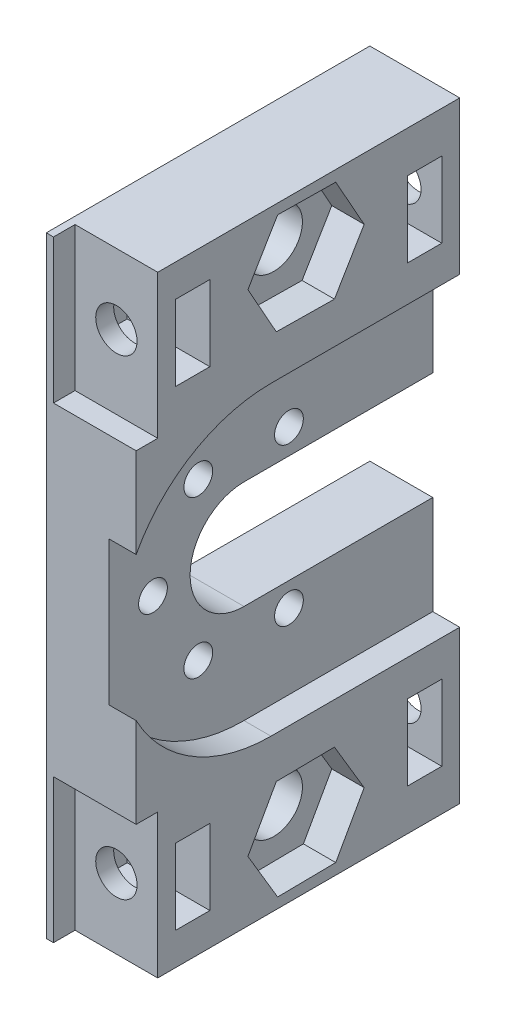
from build123d import *

# Parameters (mm, degrees)
SKETCH_1_R          = 0.8
EXTRUDE_5_DEPTH     = 5
SKETCH_6_R          = 0.8
CUT_EXTRUDE_1_DEPTH = 1.5
SKETCH_7_R          = 1.6
CUT_EXTRUDE_2_DEPTH = 21.597329924
CUT_EXTRUDE_4_DEPTH = 1.8
SKETCH_9_R          = 1.15
CUT_EXTRUDE_5_DEPTH = 1
SKETCH_10_W         = 4.2
SKETCH_10_H         = 1.9
SKETCH_10_W_2       = 8
SKETCH_10_H_2       = 1.2
CUT_EXTRUDE_6_DEPTH = 4.6
SKETCH_12_R         = 1.15
CUT_EXTRUDE_7_DEPTH = 24.741103597


with BuildPart() as part:
    # ｽｹｯﾁ1 → ﾎﾞｽ - 押し出し5 (new body)
    with BuildSketch(Plane.YZ):
        with BuildLine():
            ThreePointArc((-3, 0), (0, 3), (3, 0))
            Line((3, 0), (3, -10.5))
            Line((3, -10.5), (17, -10.5))
            Line((17, -10.5), (17, 7.5))
            Line((17, 7.5), (-17, 7.5))
            Line((-17, 7.5), (-17, -10.5))
            Line((-17, -10.5), (-3, -10.5))
            Line((-3, -10.5), (-3, 0))
        make_face()
        with Locations((-4.330127019, -2.5)):
            Circle(SKETCH_1_R, mode=Mode.SUBTRACT)
        with Locations((4.404309192, -2.5)):
            Circle(SKETCH_1_R, mode=Mode.SUBTRACT)
        with Locations((-4.330127019, 2.542829098)):
            Circle(SKETCH_1_R, mode=Mode.SUBTRACT)
        with Locations((4.404309192, 2.542829098)):
            Circle(SKETCH_1_R, mode=Mode.SUBTRACT)
        with Locations((0.037091086, 5.064243646)):
            Circle(SKETCH_1_R, mode=Mode.SUBTRACT)
    extrude(amount=-EXTRUDE_5_DEPTH)

    # ｽｹｯﾁ6 → ｶｯﾄ - 押し出し1 (cut)
    with BuildSketch(Plane.YZ):
        with BuildLine():
            Line((-3, -10.5), (-3, 0))
            ThreePointArc((-3, 0), (0, 3), (3, 0))
            Line((3, 0), (3, -10.5))
            Line((3, -10.5), (8.5, -10.5))
            Line((8.5, -10.5), (8.5, 0))
            ThreePointArc((8.5, 0), (7.288689869, 4.373213921), (4, 7.5))
            Line((4, 7.5), (-4, 7.5))
            ThreePointArc((-4, 7.5), (-7.288689869, 4.373213921), (-8.5, 0))
            Line((-8.5, 0), (-8.5, -10.5))
            Line((-8.5, -10.5), (-3, -10.5))
        make_face()
        with Locations((-4.330127019, -2.5)):
            Circle(SKETCH_6_R, mode=Mode.SUBTRACT)
        with Locations((0.037091086, 5.064243646)):
            Circle(SKETCH_6_R, mode=Mode.SUBTRACT)
        with Locations((-4.330127019, 2.542829098)):
            Circle(SKETCH_6_R, mode=Mode.SUBTRACT)
        with Locations((4.404309192, 2.542829098)):
            Circle(SKETCH_6_R, mode=Mode.SUBTRACT)
        with Locations((4.404309192, -2.5)):
            Circle(SKETCH_6_R, mode=Mode.SUBTRACT)
    extrude(amount=-CUT_EXTRUDE_1_DEPTH, mode=Mode.SUBTRACT)

    # ｽｹｯﾁ7 → ｶｯﾄ - 押し出し2 (cut, through all)
    with BuildSketch(Plane(origin=(-5, 0, 0), x_dir=(0, -1, 0), z_dir=(-1, 0, 0))):
        with Locations((-13.611024943, -1.95)):
            Circle(SKETCH_7_R)
        with Locations((13.611024943, -1.95)):
            Circle(SKETCH_7_R)
    extrude(amount=-CUT_EXTRUDE_2_DEPTH, mode=Mode.SUBTRACT)

    # ｽｹｯﾁ8 → ｶｯﾄ - 押し出し4 (cut)
    with BuildSketch(Plane.YZ):
        Polygon((10.790296163, -3.530133692), (10.832224634, -0.297244066), (13.652953414, 1.282889626), (16.431753723, -0.369866308), (16.389825252, -3.602755934), (13.569096472, -5.182889626), align=None)
        Polygon((-10.832224634, -0.297244066), (-13.652953414, 1.282889626), (-16.431753723, -0.369866308), (-16.389825252, -3.602755934), (-13.569096472, -5.182889626), (-10.790296163, -3.530133692), align=None)
    extrude(amount=-CUT_EXTRUDE_4_DEPTH, mode=Mode.SUBTRACT)

    # ｽｹｯﾁ9 → ｶｯﾄ - 押し出し5 (cut)
    with BuildSketch(Plane(origin=(0, 0, -10.5), x_dir=(1, 0, 0), z_dir=(0, 0, -1))):
        with Locations((-2.3, 12.508141571)):
            Circle(SKETCH_9_R)
        with Locations((-2.3, -12.508141571)):
            Circle(SKETCH_9_R)
    extrude(amount=-CUT_EXTRUDE_5_DEPTH, mode=Mode.SUBTRACT)

    # ｽｹｯﾁ10 → ｶｯﾄ - 押し出し6 (cut)
    with BuildSketch(Plane.YZ):
        with Locations((-12.6, -8.55)):
            Rectangle(SKETCH_10_W, SKETCH_10_H)
        with Locations((12.6, -8.55)):
            Rectangle(SKETCH_10_W, SKETCH_10_H)
        with Locations((-13.1, 4.35)):
            Rectangle(SKETCH_10_W, SKETCH_10_H)
        with Locations((13.1, 4.35)):
            Rectangle(SKETCH_10_W, SKETCH_10_H)
        with Locations((-13, 6.9)):
            Rectangle(SKETCH_10_W_2, SKETCH_10_H_2)
        with Locations((13, 6.9)):
            Rectangle(SKETCH_10_W_2, SKETCH_10_H_2)
    extrude(amount=-CUT_EXTRUDE_6_DEPTH, mode=Mode.SUBTRACT)

    # ｽｹｯﾁ12 → ｶｯﾄ - 押し出し7 (cut, through all)
    with BuildSketch(Plane(origin=(0, 0, 5.3), x_dir=(1, 0, 0), z_dir=(0, 0, -1))):
        with Locations((-2.3, 13.1)):
            Circle(SKETCH_12_R)
        with Locations((-2.3, -13.1)):
            Circle(SKETCH_12_R)
    extrude(amount=-CUT_EXTRUDE_7_DEPTH, mode=Mode.SUBTRACT)


solid = part.part
